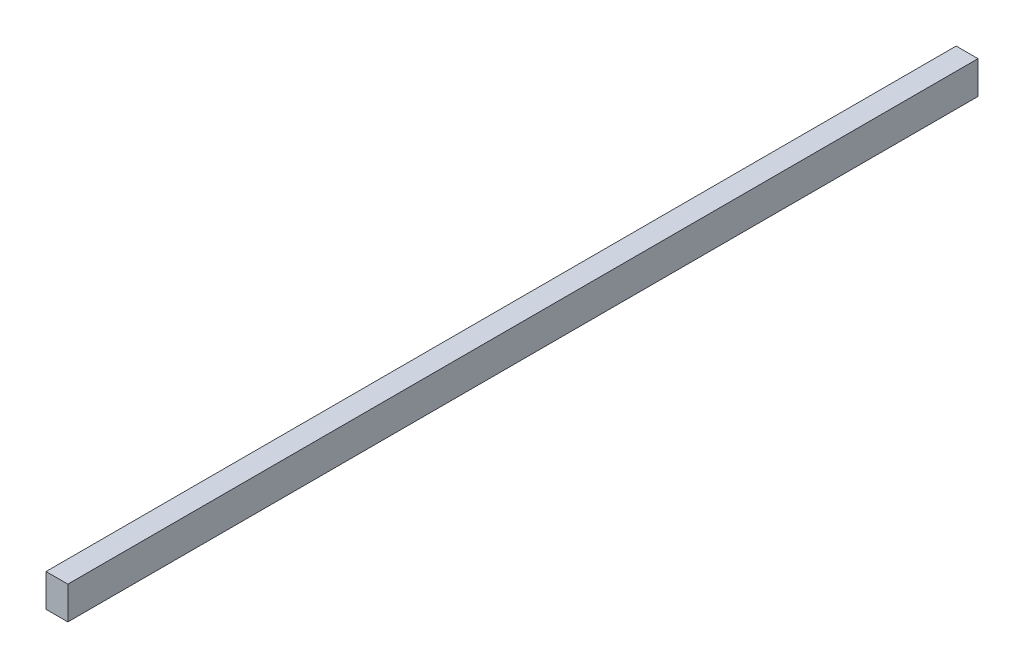
from build123d import *

# Parameters (mm, degrees)
SKETCH1_W           = 500
SKETCH1_H           = 18
BOSS_EXTRUDE1_DEPTH = 12


with BuildPart() as part:
    # Sketch1 → Boss-Extrude1 (new body)
    with BuildSketch(Plane(origin=(0, 0, 0), x_dir=(0, 0, -1), z_dir=(1, 0, 0))):
        with Locations((250, 9)):
            Rectangle(SKETCH1_W, SKETCH1_H)
    extrude(amount=BOSS_EXTRUDE1_DEPTH)


solid = part.part
